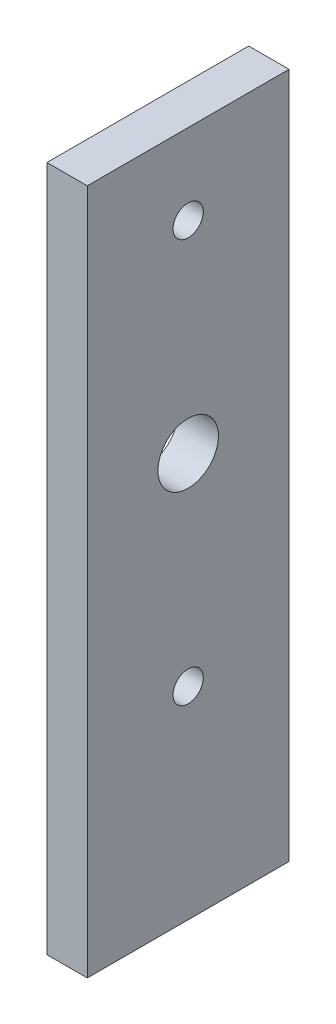
from build123d import *

# Parameters (mm, degrees)
SKETCH1_W           = 10
SKETCH1_H           = 50
BOSS_EXTRUDE1_DEPTH = 170
SKETCH2_R           = 3.75
SKETCH2_R_2         = 7.5
CUT_EXTRUDE1_DEPTH  = 10


with BuildPart() as part:
    # Sketch1 → Boss-Extrude1 (new body)
    with BuildSketch(Plane(origin=(0, 0, 0), x_dir=(1, 0, 0), z_dir=(0, 1, 0))):
        with Locations((5, 25)):
            Rectangle(SKETCH1_W, SKETCH1_H)
    extrude(amount=BOSS_EXTRUDE1_DEPTH)

    # Sketch2 → Cut-Extrude1 (cut)
    with BuildSketch(Plane(origin=(10, 0, 0), x_dir=(0, 0, -1), z_dir=(1, 0, 0))):
        with Locations((25, 50.09624614)):
            Circle(SKETCH2_R)
        with Locations((25, 150.09624614)):
            Circle(SKETCH2_R)
        with Locations((25, 100.09624614)):
            Circle(SKETCH2_R_2)
    extrude(amount=-CUT_EXTRUDE1_DEPTH, mode=Mode.SUBTRACT)


solid = part.part
